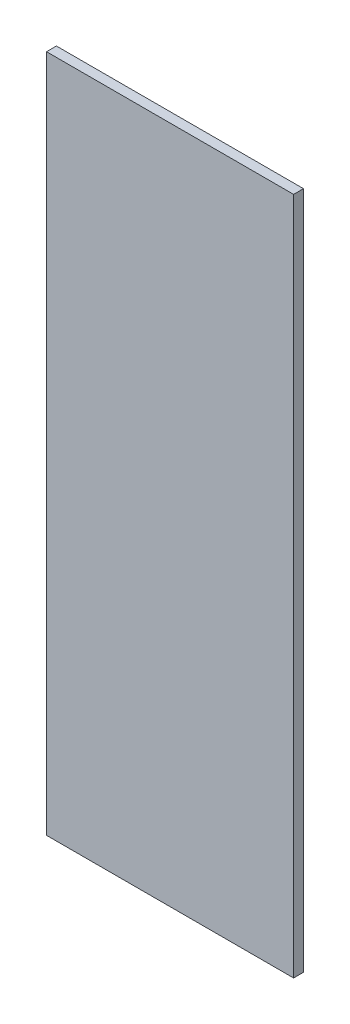
from build123d import *

# Parameters (mm, degrees)
SKETCH1_W           = 150
SKETCH1_H           = 412
BOSS_EXTRUDE1_DEPTH = 6


with BuildPart() as part:
    # Sketch1 → Boss-Extrude1 (new body)
    with BuildSketch(Plane.XY):
        with Locations((46.428571429, 183.104761905)):
            Rectangle(SKETCH1_W, SKETCH1_H)
    extrude(amount=BOSS_EXTRUDE1_DEPTH)


solid = part.part
